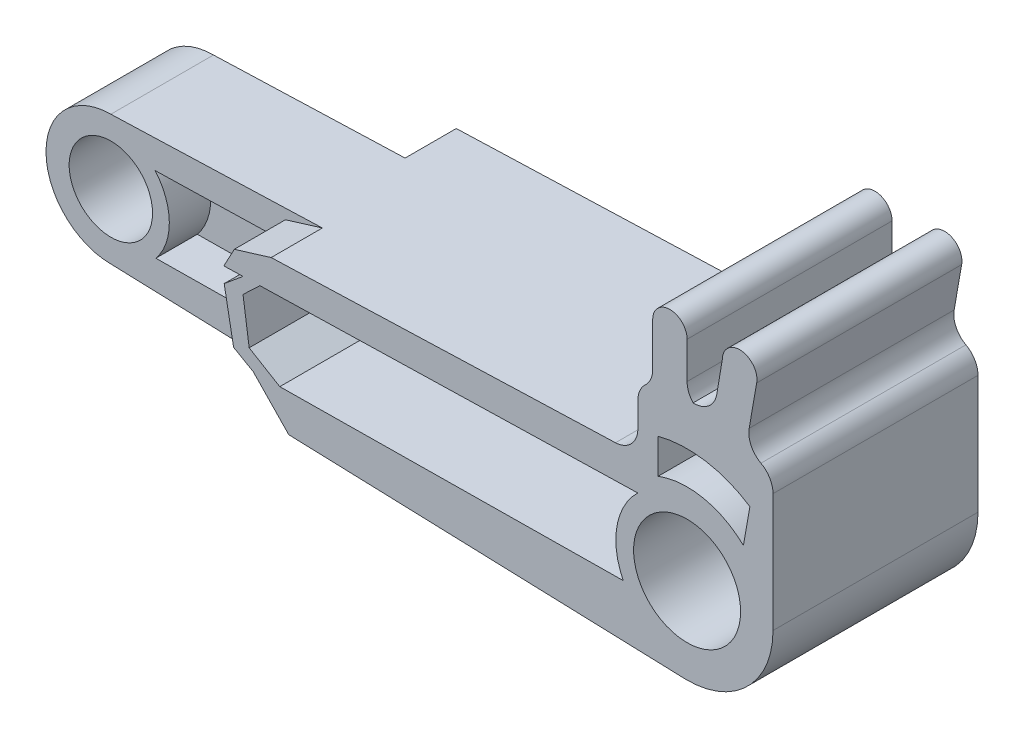
from build123d import *

# Parameters (mm, degrees)
BOSS_EXTRUDE1_DEPTH = 2.425
SKETCH4_R           = 1.8
CUT_EXTRUDE1_DEPTH  = 4.85
SKETCH5_R           = 2.31
CUT_EXTRUDE2_DEPTH  = 4.85
CUT_EXTRUDE3_DEPTH  = 4.5
CUT_EXTRUDE4_DEPTH  = 4.5
SKETCH9_R           = 1.8
CUT_EXTRUDE5_DEPTH  = 2.21
BOSS_EXTRUDE3_DEPTH = 4.5
MIRROR1_START       = -2.425
MIRROR1_DEPTH       = 0.35
MIRROR1_START_2     = -6.425
MIRROR1_2_OUTLINE_R = 2.31
MIRROR1_2_DEPTH     = 4
MIRROR1_START_3     = -4.215
MIRROR1_3_OUTLINE_R = 1.8
MIRROR1_3_DEPTH     = 1.79
MIRROR1_START_4     = -1.925
MIRROR1_4_DEPTH     = 0.35
FILLET1_R           = 1
FILLET2_R           = 1
FILLET3_START       = -7
FILLET3_DEPTH       = 10
FILLET3_START_2     = -6.425
FILLET3_2_DEPTH     = 8.85
CHAMFER1_SIZE       = 1.358599734
CHAMFER1_SIZE_2     = 0.5


with BuildPart() as part:
    # Sketch1 → Boss-Extrude1 (new, symmetric)
    with BuildSketch(Plane.XY):
        with BuildLine():
            Line((24.963832459, 6.453496101), (0, 5.6))
            ThreePointArc((0, 5.6), (-2.8, 2.8), (0, 0))
            Line((0, 0), (26.892949189, -0.904763282))
            Line((26.892949189, -0.904763282), (27.037607331, -0.909630037))
            ThreePointArc((27.037607331, -0.909630037), (29.694776689, 0.158175176), (30.8, 2.8))
            Line((30.8, 2.8), (30.8, 8.487357946))
            ThreePointArc((30.8, 8.487357946), (30.233700276, 8.818910947), (29.638041523, 9.094253316))
            Line((29.638041523, 9.094253316), (30.095317445, 11.704815446))
            ThreePointArc((30.095317445, 11.704815446), (29.424398151, 12.579078458), (28.61033706, 11.836264178))
            Line((28.61033706, 11.836264178), (28.216646516, 9.496327952))
            ThreePointArc((28.216646516, 9.496327952), (27.655285404, 9.566874672), (27.09, 9.590444787))
            Line((27.09, 9.590444787), (27.09, 11.836264178))
            ThreePointArc((27.09, 11.836264178), (26.347509808, 12.578754371), (25.605019615, 11.836264178))
            Line((25.605019615, 11.836264178), (25.605019615, 9.42608283))
            ThreePointArc((25.605019615, 9.42608283), (25.282256308, 9.345395569), (24.963832459, 9.248996201))
            Line((24.963832459, 9.248996201), (24.963832459, 6.453496101))
        make_face()
    extrude(amount=BOSS_EXTRUDE1_DEPTH, both=True)

    # Sketch4 → Cut-Extrude1 (cut)
    with BuildSketch(Plane.XY.offset(2.425)):
        with Locations((0, 2.8)):
            Circle(SKETCH4_R)
    extrude(amount=-CUT_EXTRUDE1_DEPTH, mode=Mode.SUBTRACT)

    # Sketch5 → Cut-Extrude2 (cut)
    with BuildSketch(Plane.XY.offset(2.425)):
        with Locations((27.09, 2.8)):
            Circle(SKETCH5_R)
    extrude(amount=-CUT_EXTRUDE2_DEPTH, mode=Mode.SUBTRACT)

    # Sketch6 → Cut-Extrude3 (cut)
    with BuildSketch(Plane.XY.offset(2.425)):
        with BuildLine():
            Line((24.963832459, 5.0237994), (1.911495606, 4.449077446))
            ThreePointArc((1.911495606, 4.449077446), (2.524426686, 2.823276198), (1.941578309, 1.186449398))
            Line((1.941578309, 1.186449398), (24.333229734, 1.433950995))
            ThreePointArc((24.333229734, 1.433950995), (24.059732141, 3.332305254), (24.963832459, 5.0237994))
        make_face()
    extrude(amount=-CUT_EXTRUDE3_DEPTH, mode=Mode.SUBTRACT)

    # Sketch8 → Cut-Extrude4 (cut)
    with BuildSketch(Plane.XY.offset(2.425)):
        with BuildLine():
            Line((25.837871482, 6.086629038), (25.837871482, 7.582656824))
            ThreePointArc((25.837871482, 7.582656824), (27.887646092, 7.679077048), (29.8, 6.934916217))
            Line((29.8, 6.934916217), (29.522559256, 5.340159783))
            ThreePointArc((29.522559256, 5.340159783), (27.788325332, 6.247041919), (25.837871482, 6.086629038))
        make_face()
    extrude(amount=-CUT_EXTRUDE4_DEPTH, mode=Mode.SUBTRACT)

    # Sketch9 → Cut-Extrude5 (cut)
    # profile 1 of 2: a face of its own
    with BuildSketch(Plane.XY.offset(2.425)):
        with BuildLine():
            Line((0, 0), (9.892061467, -0.332800019))
            Line((9.892061467, -0.332800019), (8.357170093, 1.257362846))
            Line((8.357170093, 1.257362846), (1.941578309, 1.186449398))
            ThreePointArc((1.941578309, 1.186449398), (2.524426686, 2.823276198), (1.911495606, 4.449077446))
            Line((1.911495606, 4.449077446), (7.090480564, 4.578195651))
            Line((7.090480564, 4.578195651), (7.773891231, 5.865783944))
            Line((7.773891231, 5.865783944), (0, 5.6))
            ThreePointArc((0, 5.6), (-2.8, 2.8), (0, 0))
        make_face()
        with Locations((0, 2.8)):
            Circle(SKETCH9_R, mode=Mode.SUBTRACT)
    # profile 2 of 2: a face of its own
    with BuildSketch(Plane.XY.offset(2.425)):
        with BuildLine():
            Line((1.941578309, 1.186449398), (8.357170093, 1.257362846))
            Line((8.357170093, 1.257362846), (7.887025479, 1.744437384))
            Line((7.887025479, 1.744437384), (7.047687655, 3.249473755))
            Line((7.047687655, 3.249473755), (8.459620317, 4.61232992))
            Line((8.459620317, 4.61232992), (7.090480564, 4.578195651))
            Line((7.090480564, 4.578195651), (1.911495606, 4.449077446))
            ThreePointArc((1.911495606, 4.449077446), (2.524426686, 2.823276198), (1.941578309, 1.186449398))
        make_face()
    extrude(amount=-CUT_EXTRUDE5_DEPTH, mode=Mode.SUBTRACT)

    # Sketch10 → Boss-Extrude3 (add)
    with BuildSketch(Plane.XY.offset(-2.075)):
        Polygon((7.915156926, 4.598755806), (7.103101675, 3.924375939), (7.5095709, 1.743316184), (8.357170093, 1.257362846), (9.503707682, 1.270035867), (8.181661024, 2.062082336), (7.916040126, 3.924375939), (8.644746772, 4.616945341), align=None)
    extrude(amount=BOSS_EXTRUDE3_DEPTH)

    # Mirror1: read off the stored shape, not the designer's step
    # Mirror1 outline → Mirror1 (cut)
    with BuildSketch(Plane.XY.offset(MIRROR1_START)):
        with BuildLine():
            ThreePointArc((24.333229734, 1.433950995), (24.059732141, 3.332305255), (24.963832459, 5.0237994))
            Line((24.963832459, 5.0237994), (8.644746772, 4.616945341))
            Line((8.644746772, 4.616945341), (7.916040126, 3.924375939))
            Line((7.916040126, 3.924375939), (8.181661024, 2.062082336))
            Line((8.181661024, 2.062082336), (9.503707682, 1.270035867))
            Line((9.503707682, 1.270035867), (24.333229734, 1.433950995))
        make_face()
        with BuildLine():
            Line((7.103101675, 3.924375939), (7.915156926, 4.598755806))
            Line((7.915156926, 4.598755806), (1.911495606, 4.449077446))
            ThreePointArc((1.911495606, 4.449077446), (2.524426686, 2.823276198), (1.941578309, 1.186449398))
            Line((1.941578309, 1.186449398), (8.357170093, 1.257362846))
            Line((8.357170093, 1.257362846), (7.5095709, 1.743316184))
            Line((7.5095709, 1.743316184), (7.103101675, 3.924375939))
        make_face()
        with BuildLine():
            Line((25.837871482, 7.582656824), (25.837871482, 6.086629038))
            ThreePointArc((25.837871482, 6.086629038), (27.788325332, 6.247041919), (29.522559256, 5.340159783))
            Line((29.522559256, 5.340159783), (29.8, 6.934916217))
            ThreePointArc((29.8, 6.934916217), (27.887646092, 7.679077048), (25.837871482, 7.582656824))
        make_face()
    extrude(amount=MIRROR1_DEPTH, mode=Mode.SUBTRACT)

    # Mirror1 2 outline → Mirror1 2 (add)
    with BuildSketch(Plane.XY.offset(MIRROR1_START_2)):
        with BuildLine():
            Line((7.090480564, 4.578195651), (7.915156926, 4.598755806))
            Line((7.915156926, 4.598755806), (7.103101675, 3.924375939))
            Line((7.103101675, 3.924375939), (7.5095709, 1.743316184))
            Line((7.5095709, 1.743316184), (8.357170093, 1.257362846))
            Line((8.357170093, 1.257362846), (9.892061467, -0.332800019))
            Line((9.892061467, -0.332800019), (27.037607331, -0.909630037))
            ThreePointArc((27.037607331, -0.909630037), (29.694776689, 0.158175176), (30.8, 2.8))
            Line((30.8, 2.8), (30.8, 8.487357946))
            ThreePointArc((30.8, 8.487357946), (30.233700276, 8.818910947), (29.638041523, 9.094253316))
            Line((29.638041523, 9.094253316), (30.095317445, 11.704815446))
            ThreePointArc((30.095317445, 11.704815446), (29.424398151, 12.579078458), (28.61033706, 11.836264178))
            Line((28.61033706, 11.836264178), (28.216646516, 9.496327952))
            ThreePointArc((28.216646516, 9.496327952), (27.655285404, 9.566874672), (27.09, 9.590444787))
            Line((27.09, 9.590444787), (27.09, 11.836264178))
            ThreePointArc((27.09, 11.836264178), (26.347509807, 12.578754371), (25.605019615, 11.836264178))
            Line((25.605019615, 11.836264178), (25.605019615, 9.42608283))
            ThreePointArc((25.605019615, 9.42608283), (25.282256308, 9.345395569), (24.963832459, 9.248996201))
            Line((24.963832459, 9.248996201), (24.963832459, 6.453496101))
            Line((24.963832459, 6.453496101), (7.773891231, 5.865783944))
            Line((7.773891231, 5.865783944), (7.090480564, 4.578195651))
        make_face()
        with BuildLine():
            Line((8.644746772, 4.616945341), (24.963832459, 5.0237994))
            ThreePointArc((24.963832459, 5.0237994), (24.059732141, 3.332305255), (24.333229734, 1.433950995))
            Line((24.333229734, 1.433950995), (9.503707682, 1.270035867))
            Line((9.503707682, 1.270035867), (8.181661024, 2.062082336))
            Line((8.181661024, 2.062082336), (7.916040126, 3.924375939))
            Line((7.916040126, 3.924375939), (8.644746772, 4.616945341))
        make_face(mode=Mode.SUBTRACT)
        with Locations((27.09, 2.8)):
            Circle(MIRROR1_2_OUTLINE_R, mode=Mode.SUBTRACT)
        with BuildLine():
            ThreePointArc((29.522559256, 5.340159783), (27.788325332, 6.247041919), (25.837871482, 6.086629038))
            Line((25.837871482, 6.086629038), (25.837871482, 7.582656824))
            ThreePointArc((25.837871482, 7.582656824), (27.887646092, 7.679077048), (29.8, 6.934916217))
            Line((29.8, 6.934916217), (29.522559256, 5.340159783))
        make_face(mode=Mode.SUBTRACT)
    extrude(amount=MIRROR1_2_DEPTH)

    # Mirror1 3 outline → Mirror1 3 (add)
    with BuildSketch(Plane.XY.offset(MIRROR1_START_3)):
        with BuildLine():
            Line((1.911495606, 4.449077446), (7.090480564, 4.578195651))
            Line((7.090480564, 4.578195651), (7.773891231, 5.865783944))
            Line((7.773891231, 5.865783944), (0, 5.6))
            ThreePointArc((0, 5.6), (-2.8, 2.8), (0, 0))
            Line((0, 0), (9.892061467, -0.332800019))
            Line((9.892061467, -0.332800019), (8.357170093, 1.257362846))
            Line((8.357170093, 1.257362846), (1.941578309, 1.186449398))
            ThreePointArc((1.941578309, 1.186449398), (2.524426686, 2.823276198), (1.911495606, 4.449077446))
        make_face()
        with Locations((0, 2.8)):
            Circle(MIRROR1_3_OUTLINE_R, mode=Mode.SUBTRACT)
    extrude(amount=MIRROR1_3_DEPTH)

    # Mirror1 4 outline → Mirror1 4 (add)
    with BuildSketch(Plane.XY.offset(MIRROR1_START_4)):
        with BuildLine():
            ThreePointArc((24.333229734, 1.433950995), (24.059732141, 3.332305255), (24.963832459, 5.0237994))
            Line((24.963832459, 5.0237994), (8.644746772, 4.616945341))
            Line((8.644746772, 4.616945341), (7.916040126, 3.924375939))
            Line((7.916040126, 3.924375939), (8.181661024, 2.062082336))
            Line((8.181661024, 2.062082336), (9.503707682, 1.270035867))
            Line((9.503707682, 1.270035867), (24.333229734, 1.433950995))
        make_face()
        with BuildLine():
            Line((7.103101675, 3.924375939), (7.915156926, 4.598755806))
            Line((7.915156926, 4.598755806), (1.911495606, 4.449077446))
            ThreePointArc((1.911495606, 4.449077446), (2.524426686, 2.823276198), (1.941578309, 1.186449398))
            Line((1.941578309, 1.186449398), (8.357170093, 1.257362846))
            Line((8.357170093, 1.257362846), (7.5095709, 1.743316184))
            Line((7.5095709, 1.743316184), (7.103101675, 3.924375939))
        make_face()
        with BuildLine():
            Line((25.837871482, 7.582656824), (25.837871482, 6.086629038))
            ThreePointArc((25.837871482, 6.086629038), (27.788325332, 6.247041919), (29.522559256, 5.340159783))
            Line((29.522559256, 5.340159783), (29.8, 6.934916217))
            ThreePointArc((29.8, 6.934916217), (27.887646092, 7.679077048), (25.837871482, 7.582656824))
        make_face()
    extrude(amount=MIRROR1_4_DEPTH)

    # Fillet1
    fillet1_edges = [part.edges().sort_by_distance(p)[0] for p in [
        (28.216646516, 9.496327952, 0),
    ]]
    fillet(fillet1_edges, radius=FILLET1_R)

    # Fillet2
    # the kernel refuses this fillet: 1 mm, written as the material it adds along each edge
    with BuildSketch(Plane(origin=(29.638041523, 9.094253316, -2.425), x_dir=(0.1725368564682428, 0.9850030625130345, 0), z_dir=(0, 0, 1))) as fillet2_piece_1:
        with BuildLine():
            CenterArc((0.764295599, -1), FILLET2_R, 90, 71.872680982)
            ThreePointArc((-0.186071892, -0.688870393), (-0.08398115, -0.346881002), (0, 0))
            Line((0, 0), (0.764295599, 0))
        make_face()
    extrude(amount=4.85)
    with BuildSketch(Plane(origin=(29.638041523, 9.094253316, -6.425), x_dir=(0.1725368564898844, 0.9850030625092436, 0), z_dir=(0, 0, 1))) as fillet2_piece_2:
        with BuildLine():
            CenterArc((0.764295599, -1), FILLET2_R, 90, 71.872680969)
            ThreePointArc((-0.186071892, -0.688870393), (-0.083981149, -0.346881002), (0, 0))
            Line((0, 0), (0.764295599, 0))
        make_face()
    extrude(amount=4)
    # the kernel refuses this fillet: 1 mm, written as the material it takes off along each edge
    with BuildSketch(Plane(origin=(24.963832459, 9.248996201, -8.315807243), x_dir=(-2.562451628141337e-10, -1.0, -3.5674664740127255e-11), z_dir=(-4.379753308299348e-11, -3.567466472890435e-11, 1.0))) as fillet2_2_piece_1:
        with BuildLine():
            CenterArc((0.756322897, 1), FILLET2_R, 201.027306576, 68.972693439)
            ThreePointArc((-0.177086629, 0.641187156), (-0.096399368, 0.31842385), (0, 0))
            Line((0, 0), (0.756322897, 0))
        make_face()
    extrude(amount=12.631614485, mode=Mode.SUBTRACT)

    # Fillet3: read off the stored shape, not the designer's step
    # Fillet3 outline → Fillet3 (cut)
    with BuildSketch(Plane.XY.offset(FILLET3_START)):
        with BuildLine():
            ThreePointArc((30.8, 8.487357946), (30.545599672, 8.645423109), (30.284476711, 8.7921164))
            ThreePointArc((30.284476711, 8.7921164), (30.661523628, 8.424957074), (30.8, 7.917239595))
            Line((30.8, 7.917239595), (30.8, 8.487357946))
        make_face()
    extrude(amount=FILLET3_DEPTH, mode=Mode.SUBTRACT)

    # Fillet3 2 outline → Fillet3 2 (add)
    with BuildSketch(Plane.XY.offset(FILLET3_START_2)):
        with BuildLine():
            Line((25.605019615, 9.42608283), (25.605019615, 9.960197633))
            ThreePointArc((25.605019615, 9.960197633), (25.521372828, 9.559826818), (25.284426037, 9.226435468))
            ThreePointArc((25.284426037, 9.226435468), (25.435212011, 9.341531609), (25.605019615, 9.42608283))
        make_face()
        with BuildLine():
            Line((24.963832459, 6.453496101), (24.963832459, 7.419891079))
            ThreePointArc((24.963832459, 7.419891079), (24.682918455, 6.724969983), (23.9980018, 6.420475021))
            Line((23.9980018, 6.420475021), (24.963832459, 6.453496101))
        make_face()
        with BuildLine():
            ThreePointArc((27.09, 9.590444787), (27.21890802, 9.589221099), (27.347769579, 9.585550475))
            ThreePointArc((27.347769579, 9.585550475), (27.156664471, 9.89668996), (27.09, 10.255695238))
            Line((27.09, 10.255695238), (27.09, 9.590444787))
        make_face()
    extrude(amount=FILLET3_2_DEPTH)

    # Chamfer1
    # the kernel refuses this chamfer: 1.358599734, 1.358599732, 0.5 mm, written as the material it takes off along each edge
    with BuildSketch(Plane(origin=(7.773891231, 5.865783944, 5.952855504), x_dir=(0.9994160575677593, 0.034169341165982005, 0), z_dir=(0, 0, -1))) as chamfer1_piece_1:
        Polygon((CHAMFER1_SIZE * 0.999999998457, 0), (-CHAMFER1_SIZE_2 * 0.498730899085, CHAMFER1_SIZE_2 * 0.866756880733), (0, 0), align=None)
    extrude(amount=5.737855504, mode=Mode.SUBTRACT)
    with BuildSketch(Plane(origin=(7.773891231, 5.865783944, -9.952855511), x_dir=(0.9994160575667841, 0.03416934119450388, 0), z_dir=(0, 0, 1))) as chamfer1_piece_2:
        Polygon((CHAMFER1_SIZE_2, 0), (-CHAMFER1_SIZE * 0.498730899684, -CHAMFER1_SIZE * 0.866756880764), (0, 0), align=None)
    extrude(amount=5.737855511, mode=Mode.SUBTRACT)


solid = part.part
